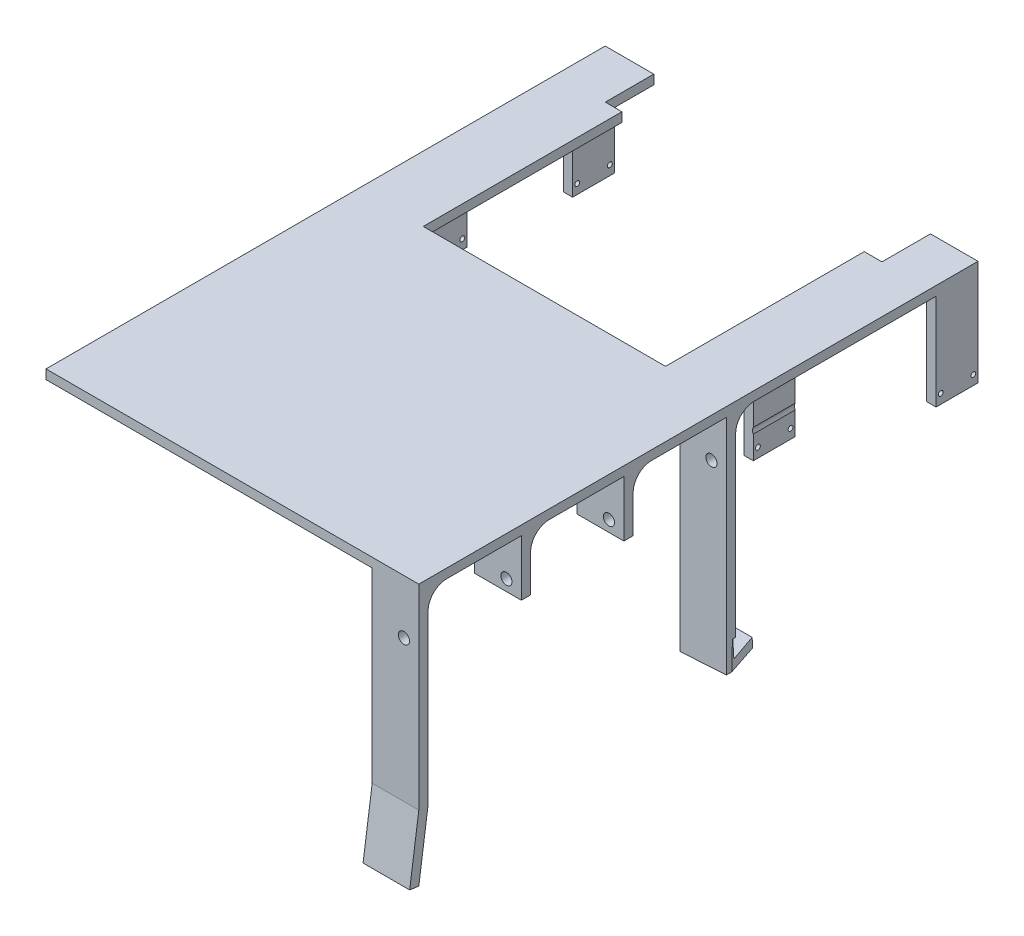
from build123d import *

# Parameters (mm, degrees)
BOSS_EXTRUDE1_DEPTH      = 5
SKETCH2_W                = 5
SKETCH2_H                = 22.5
BOSS_EXTRUDE2_DEPTH      = 38
SKETCH5_W                = 25
SKETCH5_H                = 5
BOSS_EXTRUDE3_DEPTH      = 30
FILLET3_R                = 10
SKETCH6_R                = 3
CUT_EXTRUDE4_DEPTH       = 363.552065226
SKETCH7_W                = 5
SKETCH7_H                = 22.5
BOSS_EXTRUDE4_DEPTH      = 51.5
SKETCH3_R                = 1.3
CUT_EXTRUDE2_DEPTH       = 365.214565881
SKETCH9_W                = 148.432802285
SKETCH9_H                = 26.029991845
CUT_EXTRUDE6_DEPTH       = 10
SKETCH10_W               = 25
SKETCH10_H               = 5
BOSS_EXTRUDE5_DEPTH      = 70
BOSS_EXTRUDE6_DEPTH      = 25
SKETCH12_W               = 25
SKETCH12_H               = 5
BOSS_EXTRUDE7_DEPTH      = 19.72
BOSS_EXTRUDE8_DEPTH      = 15
BOSS_EXTRUDE8_DEPTH_BACK = 5
CUT_EXTRUDE7_DEPTH       = 15


with BuildPart() as part:
    # Sketch1 → Boss-Extrude1 (new body)
    with BuildSketch(Plane(origin=(0, 0, 0), x_dir=(1, 0, 0), z_dir=(0, 1, 0))):
        Polygon((0, 0), (0, -300), (200, -300), (200, 0), (190, 0), (165, 0), (165, -132.626694389), (35, -132.626694389), (35, 0), (10, 0), align=None)
    extrude(amount=BOSS_EXTRUDE1_DEPTH)

    # Sketch2 → Boss-Extrude2 (add)
    with BuildSketch(Plane.XZ):
        with Locations((10.862944152, 98.75)):
            Rectangle(SKETCH2_W, SKETCH2_H)
        with Locations((186.943823955, 98.75)):
            Rectangle(SKETCH2_W, SKETCH2_H)
    extrude(amount=BOSS_EXTRUDE2_DEPTH)

    # Sketch5 → Boss-Extrude3 (add)
    with BuildSketch(Plane.XZ):
        with Locations((187.5, 297.5)):
            Rectangle(SKETCH5_W, SKETCH5_H)
        with Locations((187.5, 242.5)):
            Rectangle(SKETCH5_W, SKETCH5_H)
        with Locations((187.5, 187.5)):
            Rectangle(SKETCH5_W, SKETCH5_H)
        with Locations((187.5, 132.5)):
            Rectangle(SKETCH5_W, SKETCH5_H)
    extrude(amount=BOSS_EXTRUDE3_DEPTH)

    # Fillet3
    fillet3_edges = [part.edges().sort_by_distance(p)[0] for p in [
        (187.5, 0, 130),
        (187.5, 0, 185),
        (187.5, 0, 240),
        (187.5, 0, 295),
    ]]
    fillet(fillet3_edges, radius=FILLET3_R)

    # Sketch6 → Cut-Extrude4 (cut, through all)
    with BuildSketch(Plane.XY.offset(300)):
        with Locations((192, -24)):
            Circle(SKETCH6_R)
    extrude(amount=-CUT_EXTRUDE4_DEPTH, mode=Mode.SUBTRACT)

    # Sketch7 → Boss-Extrude4 (add)
    with BuildSketch(Plane.XZ):
        with Locations((2.5, 11.25)):
            Rectangle(SKETCH7_W, SKETCH7_H)
        with Locations((197.5, 11.25)):
            Rectangle(SKETCH7_W, SKETCH7_H)
    extrude(amount=BOSS_EXTRUDE4_DEPTH)

    # Sketch3 → Cut-Extrude2 (cut, through all)
    with BuildSketch(Plane(origin=(200, 0, 0), x_dir=(0, 0, -1), z_dir=(1, 0, 0))):
        with Locations((-107.5, -32.9)):
            Circle(SKETCH3_R)
        with Locations((-90, -32.9)):
            Circle(SKETCH3_R)
        with Locations((-20, -46.4)):
            Circle(SKETCH3_R)
        with Locations((-2.5, -46.4)):
            Circle(SKETCH3_R)
    extrude(amount=-CUT_EXTRUDE2_DEPTH, mode=Mode.SUBTRACT)

    # Sketch9 → Cut-Extrude6 (cut)
    with BuildSketch(Plane.XZ):
        with Locations((100.297612924, 13.014995923)):
            Rectangle(SKETCH9_W, SKETCH9_H)
    extrude(amount=-CUT_EXTRUDE6_DEPTH, mode=Mode.SUBTRACT)

    # Sketch10 → Boss-Extrude5 (add)
    with BuildSketch(Plane.XZ.offset(30)):
        with Locations((187.5, 297.5)):
            Rectangle(SKETCH10_W, SKETCH10_H)
        with Locations((187.5, 132.5)):
            Rectangle(SKETCH10_W, SKETCH10_H)
    extrude(amount=BOSS_EXTRUDE5_DEPTH)

    # Sketch11 → Boss-Extrude6 (add)
    with BuildSketch(Plane(origin=(200, 0, 0), x_dir=(0, 0, -1), z_dir=(1, 0, 0))):
        Polygon((-300, -100), (-304.901863346, -134.643852153), (-300, -135.337431613), (-295, -100), align=None)
    extrude(amount=-BOSS_EXTRUDE6_DEPTH)

    # Sketch12 → Boss-Extrude7 (add)
    with BuildSketch(Plane.XZ.offset(100)):
        with Locations((187.5, 132.5)):
            Rectangle(SKETCH12_W, SKETCH12_H)
    extrude(amount=BOSS_EXTRUDE7_DEPTH)

    # Sketch13 → Boss-Extrude8 (add, two sides: drawn at the far end of the back side and taken through both)
    with BuildSketch(Plane(origin=(0, 0, 130), x_dir=(-1, 0, 0), z_dir=(0, 0, -1)).offset(-BOSS_EXTRUDE8_DEPTH_BACK)):
        Polygon((-200, -115.314128401), (-200, -119.72), (-175, -121.261907364), (-175, -115.314128401), align=None)
    extrude(amount=BOSS_EXTRUDE8_DEPTH + BOSS_EXTRUDE8_DEPTH_BACK)

    # Sketch14 → Cut-Extrude7 (cut)
    with BuildSketch(Plane(origin=(8.11381438, -131.554828908, 0), x_dir=(0.9981034265069344, 0.061559320944247826, 0), z_dir=(0.061559320944247826, -0.9981034265069344, 0))):
        Polygon((186.357631366, 115), (192.250803398, 132.037436989), (198.015187573, 130.430954629), (197.515117956, 111.366582762), (186.357631366, 109.607523038), align=None)
    extrude(amount=-CUT_EXTRUDE7_DEPTH, mode=Mode.SUBTRACT)


solid = part.part
